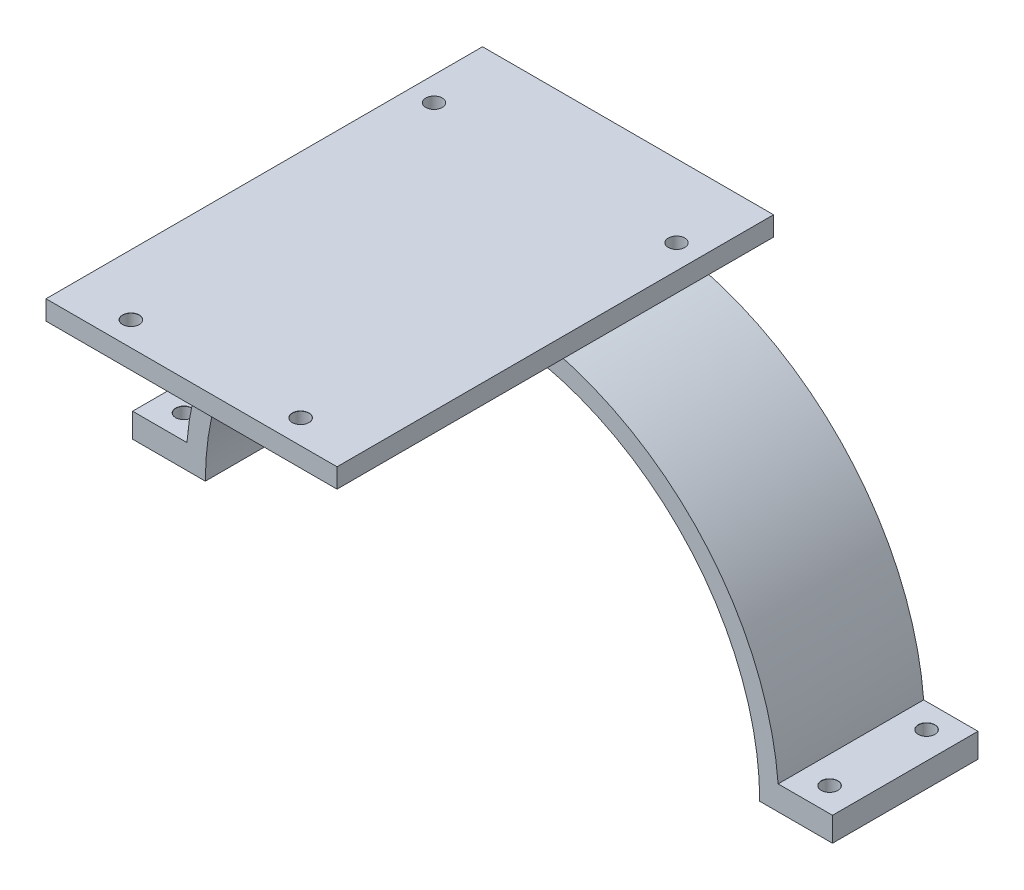
from build123d import *

# Parameters (mm, degrees)
EXTRUDE_1_DEPTH     = 30
SKETCH_2_W          = 15
SKETCH_2_H          = 5
EXTRUDE_2_DEPTH     = 30
EXTRUDE_3_DEPTH     = 30
CUT_EXTRUDE_1_REACH = 111.107
SKETCH_6_R          = 1.7
SKETCH_7_W          = 60
SKETCH_7_H          = 60
EXTRUDE_4_DEPTH     = 4


# Read off the part's stored shape, not the designer's step: M3 すきま穴1, M3 すきま穴2
with BuildPart() as part:
    # ｽｹｯﾁ1 → ﾎﾞｽ - 押し出し1 (new body)
    with BuildSketch(Plane.XY):
        with BuildLine():
            Line((-57.15, 0), (-61.15, 0))
            ThreePointArc((-61.15, 0), (0, 61.15), (61.15, 0))
            Line((61.15, 0), (57.15, 0))
            ThreePointArc((57.15, 0), (0, 57.15), (-57.15, 0))
        make_face()
    extrude(amount=EXTRUDE_1_DEPTH)

    # ｽｹｯﾁ2 → ﾎﾞｽ - 押し出し2 (add)
    with BuildSketch(Plane.XY.offset(30)):
        with Locations((-64.65, 2.5)):
            Rectangle(SKETCH_2_W, SKETCH_2_H)
        with Locations((64.65, 2.5)):
            Rectangle(SKETCH_2_W, SKETCH_2_H)
    extrude(amount=-EXTRUDE_2_DEPTH)

    # M3 すきま穴1 outline → M3 すきま穴1 (revolve, cut)
    with BuildSketch(Plane(origin=(66.547620908, 0, 25), x_dir=(1, 0, 0), z_dir=(0, 0, 1))):
        Polygon((0, 0), (1.7, 0), (1.7, 4.97124079), (1.725, 5), (0, 5), align=None)
    revolve(axis=Axis((66.547620908, 0, 25), (0, 1, 0)), mode=Mode.SUBTRACT)

    # Hole Wizard M3 _1 2 outline → Hole Wizard M3 _1 2 (revolve, cut)
    with BuildSketch(Plane(origin=(66.547620908, 0, 5), x_dir=(1, 0, 0), z_dir=(0, 0, 1))):
        Polygon((0, 0), (1.7, 0), (1.7, 4.97124079), (1.725, 5), (0, 5), align=None)
    revolve(axis=Axis((66.547620908, 0, 5), (0, 1, 0)), mode=Mode.SUBTRACT)

    # Hole Wizard M3 _1 3 outline → Hole Wizard M3 _1 3 (revolve, cut)
    with BuildSketch(Plane(origin=(-66.547620908, 0, 25), x_dir=(1, 0, 0), z_dir=(0, 0, 1))):
        Polygon((0, 0), (1.7, 0), (1.7, 4.97124079), (1.725, 5), (0, 5), align=None)
    revolve(axis=Axis((-66.547620908, 0, 25), (0, 1, 0)), mode=Mode.SUBTRACT)

    # Hole Wizard M3 _1 4 outline → Hole Wizard M3 _1 4 (revolve, cut)
    with BuildSketch(Plane(origin=(-66.547620908, 0, 5), x_dir=(1, 0, 0), z_dir=(0, 0, 1))):
        Polygon((0, 0), (1.7, 0), (1.7, 4.97124079), (1.725, 5), (0, 5), align=None)
    revolve(axis=Axis((-66.547620908, 0, 5), (0, 1, 0)), mode=Mode.SUBTRACT)

    # ｽｹｯﾁ5 → ﾎﾞｽ - 押し出し3 (add)
    with BuildSketch(Plane.XY.offset(30)):
        Polygon((-15, 57.15), (15, 57.15), (15, 72.15), (30, 72.15), (30, 76.15), (-30, 76.15), (-30, 72.15), (-15, 72.15), align=None)
    extrude(amount=-EXTRUDE_3_DEPTH)

    # ｽｹｯﾁ6 → ｶｯﾄ - 押し出し1 (cut, up to next)
    with BuildSketch(Plane(origin=(0, 76.15, 0), x_dir=(1, 0, 0), z_dir=(0, 1, 0)), mode=Mode.PRIVATE) as cut_extrude_1_sk1:
        with Locations(Location((-25, -15, 0), (0, 0, 180))):
            Circle(SKETCH_6_R)
    cut_extrude_1_tool1 = extrude(cut_extrude_1_sk1.sketch, amount=-CUT_EXTRUDE_1_REACH, mode=Mode.PRIVATE) & part.part
    # ｽｹｯﾁ6 → ｶｯﾄ - 押し出し1 (cut, up to next)
    with BuildSketch(Plane(origin=(0, 76.15, 0), x_dir=(1, 0, 0), z_dir=(0, 1, 0)), mode=Mode.PRIVATE) as cut_extrude_1_sk2:
        with Locations(Location((25, -15, 0), (0, 0, 180))):
            Circle(SKETCH_6_R)
    cut_extrude_1_tool2 = extrude(cut_extrude_1_sk2.sketch, amount=-CUT_EXTRUDE_1_REACH, mode=Mode.PRIVATE) & part.part
    add(cut_extrude_1_tool1.solids().sort_by_distance((-25, 76.15, 15))[0], mode=Mode.SUBTRACT)
    add(cut_extrude_1_tool2.solids().sort_by_distance((25, 76.15, 15))[0], mode=Mode.SUBTRACT)

    # ｽｹｯﾁ7 → ﾎﾞｽ - 押し出し4 (add)
    with BuildSketch(Plane(origin=(0, 76.15, 0), x_dir=(1, 0, 0), z_dir=(0, 1, 0))):
        with Locations((0, -60)):
            Rectangle(SKETCH_7_W, SKETCH_7_H)
    extrude(amount=-EXTRUDE_4_DEPTH)

    # M3 すきま穴2 outline → M3 すきま穴2 (revolve, cut)
    with BuildSketch(Plane(origin=(-17.5, 0, 85), x_dir=(1, 0, 0), z_dir=(0, 0, 1))):
        Polygon((0, 72.15), (1.7, 72.15), (1.7, 76.12124079), (1.725, 76.15), (0, 76.15), align=None)
    revolve(axis=Axis((-17.5, 0, 85), (0, 1, 0)), mode=Mode.SUBTRACT)

    # Hole Wizard M3 _2 2 outline → Hole Wizard M3 _2 2 (revolve, cut)
    with BuildSketch(Plane(origin=(17.5, 0, 85), x_dir=(1, 0, 0), z_dir=(0, 0, 1))):
        Polygon((0, 72.15), (1.7, 72.15), (1.7, 76.12124079), (1.725, 76.15), (0, 76.15), align=None)
    revolve(axis=Axis((17.5, 0, 85), (0, 1, 0)), mode=Mode.SUBTRACT)


solid = part.part
